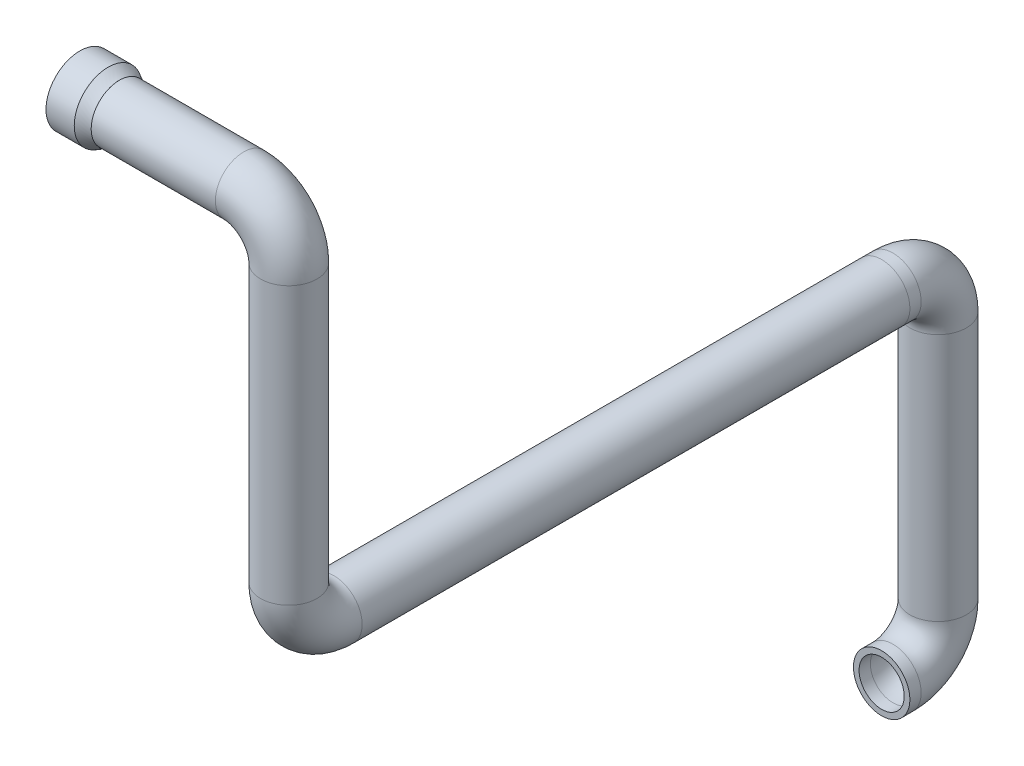
from build123d import *

# Parameters (mm, degrees)
SKETCH1_R           = 5
SKETCH1_R_2         = 4
SKETCH5_R           = 5
SKETCH5_R_2         = 4
BOSS_EXTRUDE2_START = 20
SKETCH6_R           = 5
SKETCH6_R_2         = 4
BOSS_EXTRUDE2_DEPTH = 20
SKETCH9_R           = 6
BOSS_EXTRUDE3_DEPTH = 5
SKETCH10_R          = 5
CUT_EXTRUDE1_DEPTH  = 5
SKETCH11_R          = 4
CUT_EXTRUDE2_DEPTH  = 5


with BuildPart() as part:
    # Sweep1: sweep along a path in Sketch2
    with BuildLine(Plane(origin=(0, 0, 0), x_dir=(0, 0, -1), z_dir=(1, 0, 0))) as sweep1_path:
        Line((0, 0), (2, 0))
        ThreePointArc((2, 0), (7.656854249, 2.343145751), (10, 8))
        Line((10, 8), (10, 52))
        ThreePointArc((10, 52), (7.656854249, 57.656854249), (2, 60))
        Line((2, 60), (0, 60))
        Line((0, 60), (-97, 60))
        ThreePointArc((-97, 60), (-102.656854249, 62.343145751), (-105, 68))
        Line((-105, 68), (-105, 115))
    # Sketch1 → Sweep1 (sweep)
    with BuildSketch(Plane.XY):
        Circle(SKETCH1_R)
        Circle(SKETCH1_R_2, mode=Mode.SUBTRACT)
    sweep(path=sweep1_path.line)

    # Sweep2: sweep along a path in Sketch4
    with BuildLine(Plane(origin=(0, 0, 105), x_dir=(-1, 0, 0), z_dir=(0, 0, -1))) as sweep2_path:
        Line((0, 115), (0, 117))
        ThreePointArc((0, 117), (2.343145751, 122.656854249), (8, 125))
        Line((8, 125), (10, 125))
    # Sketch5 → Sweep2 (sweep)
    with BuildSketch(Plane(origin=(0, 115, 0), x_dir=(1, 0, 0), z_dir=(0, 1, 0))):
        with Locations((0, -105)):
            Circle(SKETCH5_R)
        with Locations((0, -105)):
            Circle(SKETCH5_R_2, mode=Mode.SUBTRACT)
    sweep(path=sweep2_path.line)

    # Sketch6 → Boss-Extrude2 (add)
    with BuildSketch(Plane.ZY.offset(10).offset(BOSS_EXTRUDE2_START)):
        with Locations((105, 125)):
            Circle(SKETCH6_R)
        with Locations((105, 125)):
            Circle(SKETCH6_R_2, mode=Mode.SUBTRACT)
    extrude(amount=-BOSS_EXTRUDE2_DEPTH)


with BuildPart() as body_2:
    # Loft1: read off the stored shape, not the designer's step
    # Loft1: loft between two sections, ruled curve by curve
    loft1_from = [
        Edge.make_bspline([(-30, 125.626666168, 109.960573507), (-30, 135.547813181, 108.707241171), (-30, 134.294480845, 98.786094158), (-30, 124.373333832, 100.039426493), (-30, 114.452186819, 101.292758829), (-30, 115.705519155, 111.213905842), (-30, 125.626666168, 109.960573507)], [0, 0, 0, 0, 0.5, 0.5, 0.5, 1, 1, 1, 1], 3, [1, 0.333333333, 0.333333333, 1, 0.333333333, 0.333333333, 1]),
    ]
    loft1_to = [
        Edge.make_bspline([(-32, 127.282161582, 110.549030412), (-32, 138.380222406, 105.984707248), (-32, 133.815899242, 94.886646424), (-32, 122.717838418, 99.450969588), (-32, 111.619777594, 104.015292752), (-32, 116.184100758, 115.113353576), (-32, 127.282161582, 110.549030412)], [0, 0, 0, 0, 0.5, 0.5, 0.5, 1, 1, 1, 1], 3, [1, 0.333333333, 0.333333333, 1, 0.333333333, 0.333333333, 1]),
    ]
    loft1 = Solid(Shell([*[Face.make_surface_from_curves(loft1_from[k], loft1_to[k]) for k in range(1)], Face(Wire(loft1_from)), Face(Wire(loft1_to))]))
    add(loft1)

    # Sketch9 → Boss-Extrude3 (add)
    with BuildSketch(Plane.ZY.offset(32)):
        with Locations(Location((105, 125, 0), (0, 0, 22.356))):
            Circle(SKETCH9_R)
    extrude(amount=BOSS_EXTRUDE3_DEPTH)

    # Sketch10 → Cut-Extrude1 (cut)
    with BuildSketch(Plane.ZY.offset(37)):
        with Locations((105, 125)):
            Circle(SKETCH10_R)
    extrude(amount=-CUT_EXTRUDE1_DEPTH, mode=Mode.SUBTRACT)

    # Sketch11 → Cut-Extrude2 (cut)
    with BuildSketch(Plane.ZY.offset(32)):
        with Locations((105, 125)):
            Circle(SKETCH11_R)
    extrude(amount=-CUT_EXTRUDE2_DEPTH, mode=Mode.SUBTRACT)


solid = Compound([part.part, body_2.part])
